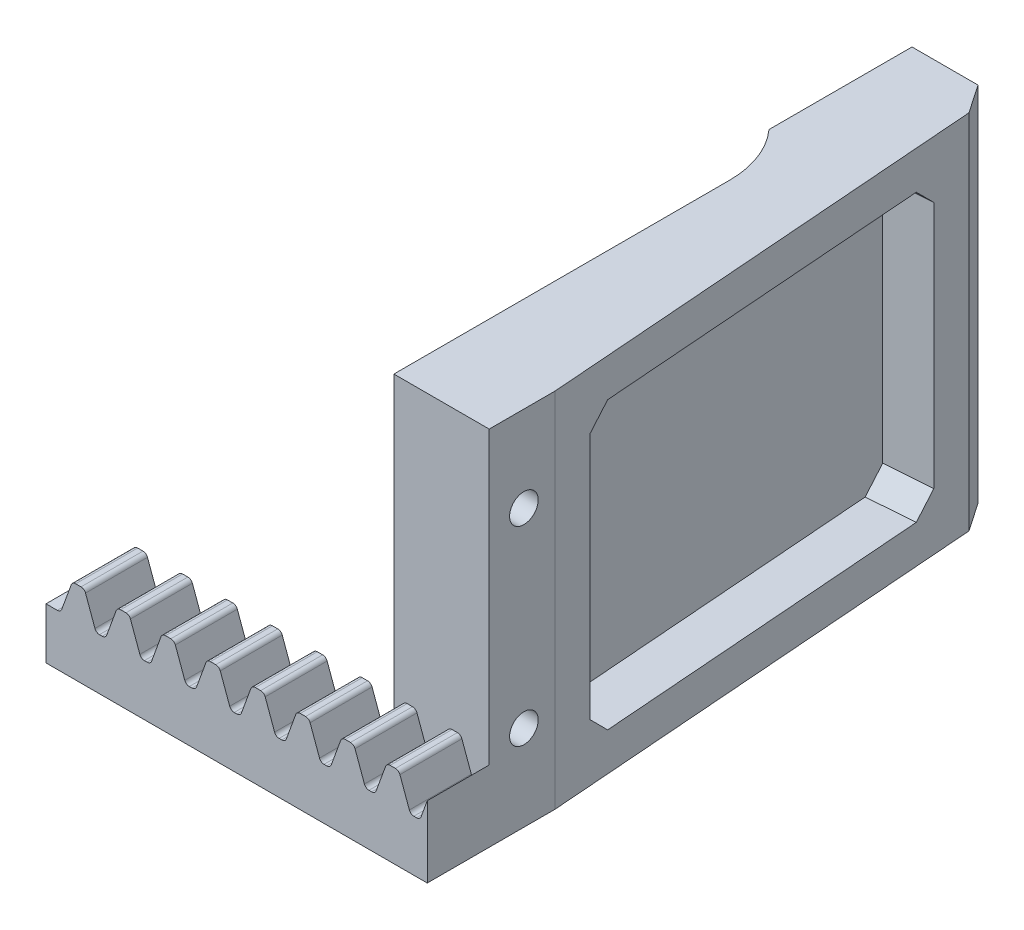
from build123d import *

# Parameters (mm, degrees)
BOSS_EXTRUDE1_DEPTH      = 7.5
BOSS_EXTRUDE1_DEPTH_BACK = 7.5
SKETCH3_W                = 200
SKETCH3_H                = 15
CUT_EXTRUDE1_DEPTH       = 101.560926806
FILLET1_R                = 0.503257554
LPATTERN1_COUNT          = 42
LPATTERN1_PITCH          = 4.71238898
FILLET1_OF_LPATTERN1_R   = 0.503257554
CUT_EXTRUDE2_DEPTH       = 101.560926806
CUT_EXTRUDE2_DEPTH_BACK  = 101.560926806
SKETCH5_W                = 4.71238898
SKETCH5_H                = 3.375
CUT_EXTRUDE3_DEPTH       = 101.560926806
CUT_EXTRUDE3_DEPTH_BACK  = 101.560926806
SKETCH6_W                = 13.890612777
SKETCH6_H                = 21.950597968
CUT_EXTRUDE6_DEPTH       = 101.560926806
CUT_EXTRUDE6_DEPTH_BACK  = 101.560926806
SKETCH8_W                = 175.100830171
SKETCH8_H                = 44.946806771
SKETCH9_W                = 55.501850732
SKETCH9_H                = 10.784038355
CUT_EXTRUDE7_DEPTH       = 101.560926806
SKETCH10_W               = 10
SKETCH10_H               = 38
BOSS_EXTRUDE2_DEPTH      = 6.9
SKETCH11_W               = 12.54
SKETCH11_H               = 38
BOSS_EXTRUDE3_DEPTH      = 50
SKETCH12_W               = 2.54
SKETCH12_H               = 35
CUT_EXTRUDE8_DEPTH       = 121.701325593
CHAMFER1_SIZE            = 3
CHAMFER1_SIZE2           = 1.816762814
FILLET2_R                = 10
SKETCH13_W               = 39.144192087
SKETCH13_H               = 30
CUT_EXTRUDE9_DEPTH       = 5
CHAMFER2_SIZE            = 2
SKETCH14_R               = 1.5
CUT_EXTRUDE10_DEPTH      = 78.944675893


with BuildPart() as part:
    # Sketch3 → Boss-Extrude1 (new, two sides: drawn at the far end of the back side and taken through both)
    with BuildSketch(Plane.XY.offset(-BOSS_EXTRUDE1_DEPTH_BACK)):
        Rectangle(SKETCH3_W, SKETCH3_H)
    extrude(amount=BOSS_EXTRUDE1_DEPTH + BOSS_EXTRUDE1_DEPTH_BACK)

    # Sketch4 → Cut-Extrude1 (cut, symmetric)
    with BuildSketch(Plane.XY):
        Polygon((-94.247779608, 7.5), (-94.247779608, 4.125), (-94.743432664, 4.125), (-95.971832204, 7.5), align=None)
        Polygon((-97.236115992, 7.5), (-98.464515532, 4.125), (-98.960168588, 4.125), (-98.960168588, 7.5), align=None)
    cut_extrude1 = extrude(amount=CUT_EXTRUDE1_DEPTH, both=True, mode=Mode.SUBTRACT)

    # Fillet1
    fillet1_edges = [part.edges().sort_by_distance(p)[0] for p in [
        (-95.971832204, 7.5, 0),
        (-94.743432664, 4.125, 0),
        (-97.236115992, 7.5, 0),
        (-98.464515532, 4.125, 0),
    ]]
    fillet(fillet1_edges, radius=FILLET1_R)

    # LPattern1: Cut-Extrude1 ×42
    with Locations(*[(i * LPATTERN1_PITCH, 0, 0) for i in range(1, LPATTERN1_COUNT)]):
        add(cut_extrude1, mode=Mode.SUBTRACT)

    # Fillet1 of LPattern1
    fillet1_of_lpattern1_edges = [part.edges().sort_by_distance(p)[0] for p in [
        (-91.259443224, 7.5, 0),
        (-90.031043683, 4.125, 0),
        (-92.523727011, 7.5, 0),
        (-93.752126552, 4.125, 0),
        (-86.547054243, 7.5, 0),
        (-85.318654703, 4.125, 0),
        (-87.811338031, 7.5, 0),
        (-89.039737571, 4.125, 0),
        (-81.834665263, 7.5, 0),
        (-80.606265722, 4.125, 0),
        (-83.09894905, 7.5, 0),
        (-84.327348591, 4.125, 0),
        (-77.122276283, 7.5, 0),
        (-75.893876742, 4.125, 0),
        (-78.38656007, 7.5, 0),
        (-79.614959611, 4.125, 0),
        (-72.409887302, 7.5, 0),
        (-71.181487762, 4.125, 0),
        (-73.67417109, 7.5, 0),
        (-74.90257063, 4.125, 0),
        (-67.697498322, 7.5, 0),
        (-66.469098781, 4.125, 0),
        (-68.961782109, 7.5, 0),
        (-70.19018165, 4.125, 0),
        (-62.985109342, 7.5, 0),
        (-61.756709801, 4.125, 0),
        (-64.249393129, 7.5, 0),
        (-65.47779267, 4.125, 0),
        (-58.272720361, 7.5, 0),
        (-57.04432082, 4.125, 0),
        (-59.537004149, 7.5, 0),
        (-60.765403689, 4.125, 0),
        (-53.560331381, 7.5, 0),
        (-52.33193184, 4.125, 0),
        (-54.824615168, 7.5, 0),
        (-56.053014709, 4.125, 0),
        (-48.8479424, 7.5, 0),
        (-47.61954286, 4.125, 0),
        (-50.112226188, 7.5, 0),
        (-51.340625728, 4.125, 0),
        (-44.13555342, 7.5, 0),
        (-42.907153879, 4.125, 0),
        (-45.399837207, 7.5, 0),
        (-46.628236748, 4.125, 0),
        (-39.42316444, 7.5, 0),
        (-38.194764899, 4.125, 0),
        (-40.687448227, 7.5, 0),
        (-41.915847768, 4.125, 0),
        (-34.710775459, 7.5, 0),
        (-33.482375919, 4.125, 0),
        (-35.975059247, 7.5, 0),
        (-37.203458787, 4.125, 0),
        (-29.998386479, 7.5, 0),
        (-28.769986938, 4.125, 0),
        (-31.262670266, 7.5, 0),
        (-32.491069807, 4.125, 0),
        (-25.285997498, 7.5, 0),
        (-24.057597958, 4.125, 0),
        (-26.550281286, 7.5, 0),
        (-27.778680826, 4.125, 0),
        (-20.573608518, 7.5, 0),
        (-19.345208977, 4.125, 0),
        (-21.837892305, 7.5, 0),
        (-23.066291846, 4.125, 0),
        (-15.861219538, 7.5, 0),
        (-14.632819997, 4.125, 0),
        (-17.125503325, 7.5, 0),
        (-18.353902866, 4.125, 0),
        (-11.148830557, 7.5, 0),
        (-9.920431017, 4.125, 0),
        (-12.413114345, 7.5, 0),
        (-13.641513885, 4.125, 0),
        (-6.436441577, 7.5, 0),
        (-5.208042036, 4.125, 0),
        (-7.700725364, 7.5, 0),
        (-8.929124905, 4.125, 0),
        (-1.724052597, 7.5, 0),
        (-0.495653056, 4.125, 0),
        (-2.988336384, 7.5, 0),
        (-4.216735925, 4.125, 0),
        (2.988336384, 7.5, 0),
        (4.216735925, 4.125, 0),
        (1.724052596, 7.5, 0),
        (0.495653056, 4.125, 0),
        (7.700725364, 7.5, 0),
        (8.929124905, 4.125, 0),
        (6.436441577, 7.5, 0),
        (5.208042036, 4.125, 0),
        (12.413114345, 7.5, 0),
        (13.641513885, 4.125, 0),
        (11.148830557, 7.5, 0),
        (9.920431017, 4.125, 0),
        (17.125503325, 7.5, 0),
        (18.353902866, 4.125, 0),
        (15.861219538, 7.5, 0),
        (14.632819997, 4.125, 0),
        (21.837892305, 7.5, 0),
        (23.066291846, 4.125, 0),
        (20.573608518, 7.5, 0),
        (19.345208977, 4.125, 0),
        (26.550281286, 7.5, 0),
        (27.778680826, 4.125, 0),
        (25.285997498, 7.5, 0),
        (24.057597958, 4.125, 0),
        (31.262670266, 7.5, 0),
        (32.491069807, 4.125, 0),
        (29.998386479, 7.5, 0),
        (28.769986938, 4.125, 0),
        (35.975059247, 7.5, 0),
        (37.203458787, 4.125, 0),
        (34.710775459, 7.5, 0),
        (33.482375919, 4.125, 0),
        (40.687448227, 7.5, 0),
        (41.915847768, 4.125, 0),
        (39.42316444, 7.5, 0),
        (38.194764899, 4.125, 0),
        (45.399837207, 7.5, 0),
        (46.628236748, 4.125, 0),
        (44.13555342, 7.5, 0),
        (42.907153879, 4.125, 0),
        (50.112226188, 7.5, 0),
        (51.340625728, 4.125, 0),
        (48.8479424, 7.5, 0),
        (47.61954286, 4.125, 0),
        (54.824615168, 7.5, 0),
        (56.053014709, 4.125, 0),
        (53.560331381, 7.5, 0),
        (52.33193184, 4.125, 0),
        (59.537004148, 7.5, 0),
        (60.765403689, 4.125, 0),
        (58.272720361, 7.5, 0),
        (57.04432082, 4.125, 0),
        (64.249393129, 7.5, 0),
        (65.47779267, 4.125, 0),
        (62.985109341, 7.5, 0),
        (61.756709801, 4.125, 0),
        (68.961782109, 7.5, 0),
        (70.19018165, 4.125, 0),
        (67.697498322, 7.5, 0),
        (66.469098781, 4.125, 0),
        (73.67417109, 7.5, 0),
        (74.90257063, 4.125, 0),
        (72.409887302, 7.5, 0),
        (71.181487762, 4.125, 0),
        (78.38656007, 7.5, 0),
        (79.614959611, 4.125, 0),
        (77.122276283, 7.5, 0),
        (75.893876742, 4.125, 0),
        (83.09894905, 7.5, 0),
        (84.327348591, 4.125, 0),
        (81.834665263, 7.5, 0),
        (80.606265722, 4.125, 0),
        (87.811338031, 7.5, 0),
        (89.039737571, 4.125, 0),
        (86.547054243, 7.5, 0),
        (85.318654703, 4.125, 0),
        (92.523727011, 7.5, 0),
        (93.752126552, 4.125, 0),
        (91.259443224, 7.5, 0),
        (90.031043683, 4.125, 0),
        (97.236115992, 7.5, 0),
        (98.464515532, 4.125, 0),
        (95.971832204, 7.5, 0),
        (94.743432664, 4.125, 0),
    ]]
    fillet(fillet1_of_lpattern1_edges, radius=FILLET1_OF_LPATTERN1_R)

    # Sketch5 → Cut-Extrude2 (cut, two sides: drawn at the far end of the back side and taken through both)
    with BuildSketch(Plane.XY.offset(-CUT_EXTRUDE2_DEPTH_BACK)):
        with Locations((-101.316363078, 5.8125)):
            Rectangle(SKETCH5_W, SKETCH5_H)
        with Locations((101.316363078, 5.8125)):
            Rectangle(SKETCH5_W, SKETCH5_H)
    extrude(amount=CUT_EXTRUDE2_DEPTH + CUT_EXTRUDE2_DEPTH_BACK, mode=Mode.SUBTRACT)

    # Sketch6 → Cut-Extrude3 (cut, two sides: drawn at the far end of the back side and taken through both)
    with BuildSketch(Plane(origin=(0, 0, 0), x_dir=(0, 0, -1), z_dir=(1, 0, 0)).offset(-CUT_EXTRUDE3_DEPTH_BACK)):
        with Locations((5.945306389, -0.750264579)):
            Rectangle(SKETCH6_W, SKETCH6_H)
    extrude(amount=CUT_EXTRUDE3_DEPTH + CUT_EXTRUDE3_DEPTH_BACK, mode=Mode.SUBTRACT)

    # Sketch8 → Cut-Extrude6 (cut, two sides: drawn at the far end of the back side and taken through both)
    with BuildSketch(Plane.XY.offset(-CUT_EXTRUDE6_DEPTH_BACK)):
        with Locations((27.550415086, 7.242613414)):
            Rectangle(SKETCH8_W, SKETCH8_H)
    extrude(amount=CUT_EXTRUDE6_DEPTH + CUT_EXTRUDE6_DEPTH_BACK, mode=Mode.SUBTRACT)

    # Sketch9 → Cut-Extrude7 (cut, through all)
    with BuildSketch(Plane.XY):
        with Locations((-76.828993169, -6.642019178)):
            Rectangle(SKETCH9_W, SKETCH9_H)
    extrude(amount=CUT_EXTRUDE7_DEPTH, mode=Mode.SUBTRACT)

    # Sketch10 → Boss-Extrude2 (add)
    with BuildSketch(Plane(origin=(0, 0, 1), x_dir=(-1, 0, 0), z_dir=(0, 0, -1))):
        with Locations((65, 17.75)):
            Rectangle(SKETCH10_W, SKETCH10_H)
    extrude(amount=BOSS_EXTRUDE2_DEPTH)

    # Sketch11 → Boss-Extrude3 (add)
    with BuildSketch(Plane(origin=(0, 0, -5.9), x_dir=(-1, 0, 0), z_dir=(0, 0, -1))):
        with Locations((66.27, 17.75)):
            Rectangle(SKETCH11_W, SKETCH11_H)
    extrude(amount=BOSS_EXTRUDE3_DEPTH)

    # Sketch12 → Cut-Extrude8 (cut, through all)
    with BuildSketch(Plane.XZ.offset(1.25)):
        with Locations((-71.27, -23.4)):
            Rectangle(SKETCH12_W, SKETCH12_H)
        Polygon((-60, -5.9), (-63.8, -55.9), (-60, -55.9), align=None)
    extrude(amount=-CUT_EXTRUDE8_DEPTH, mode=Mode.SUBTRACT)

    # Chamfer1
    chamfer1_edges = [part.edges().sort_by_distance(p)[0] for p in [
        (-63.8, 17.75, -55.9),
    ]]
    chamfer1_side = [part.faces().sort_by_distance(p)[0] for p in [
        (-61.9, 17.75, -30.9),
    ]]
    chamfer(chamfer1_edges, length=CHAMFER1_SIZE, length2=CHAMFER1_SIZE2, reference=chamfer1_side[0])

    # Fillet2
    # the kernel refuses this fillet: 10 mm, written as the material it adds along each edge
    with BuildSketch(Plane(origin=(-70, -1.25, -40.9), x_dir=(-1, 0, 0), z_dir=(0, 1, 0))) as fillet2_piece_1:
        with BuildLine():
            CenterArc((10, 6.659459438), FILLET2_R, 180, 41.754936598)
            Line((0, 6.659459438), (-0.2, 6.659459438))
            Line((-0.2, 6.659459438), (-0.2, 0))
            Line((-0.2, 0), (0, -0.2))
            ThreePointArc((0, -0.2), (1.27, -0.2), (2.3908, -0.133189189))
            Line((2.3908, -0.133189189), (2.54, 0))
        make_face()
    extrude(amount=38)

    # Sketch13 → Cut-Extrude9 (cut)
    with BuildSketch(Plane(origin=(-59.20960532, 0, 4.499930004), x_dir=(-0.07578145826840343, 0, -0.997124450900044), z_dir=(0.997124450900044, 0, -0.07578145826840343))):
        with Locations((34.0020178, 17.75)):
            Rectangle(SKETCH13_W, SKETCH13_H)
    extrude(amount=-CUT_EXTRUDE9_DEPTH, mode=Mode.SUBTRACT)

    # Chamfer2
    chamfer2_edges = [part.edges().sort_by_distance(p)[0] for p in [
        (-62.79593696, 2.75, -9.699044158),
        (-62.79593696, 32.75, -9.699044158),
        (-65.762340919, 32.75, -48.730675198),
        (-65.762340919, 2.75, -48.730675198),
    ]]
    chamfer(chamfer2_edges, length=CHAMFER2_SIZE)

    # Sketch14 → Cut-Extrude10 (cut, through all)
    with BuildSketch(Plane(origin=(-60, 0, 0), x_dir=(0, 0, -1), z_dir=(1, 0, 0))):
        with Locations(Location((2.64, 27.75, 0), (0, 0, 90))):
            Circle(SKETCH14_R)
        with Locations(Location((2.64, 7.75, 0), (0, 0, 90))):
            Circle(SKETCH14_R)
    extrude(amount=-CUT_EXTRUDE10_DEPTH, mode=Mode.SUBTRACT)


solid = part.part
